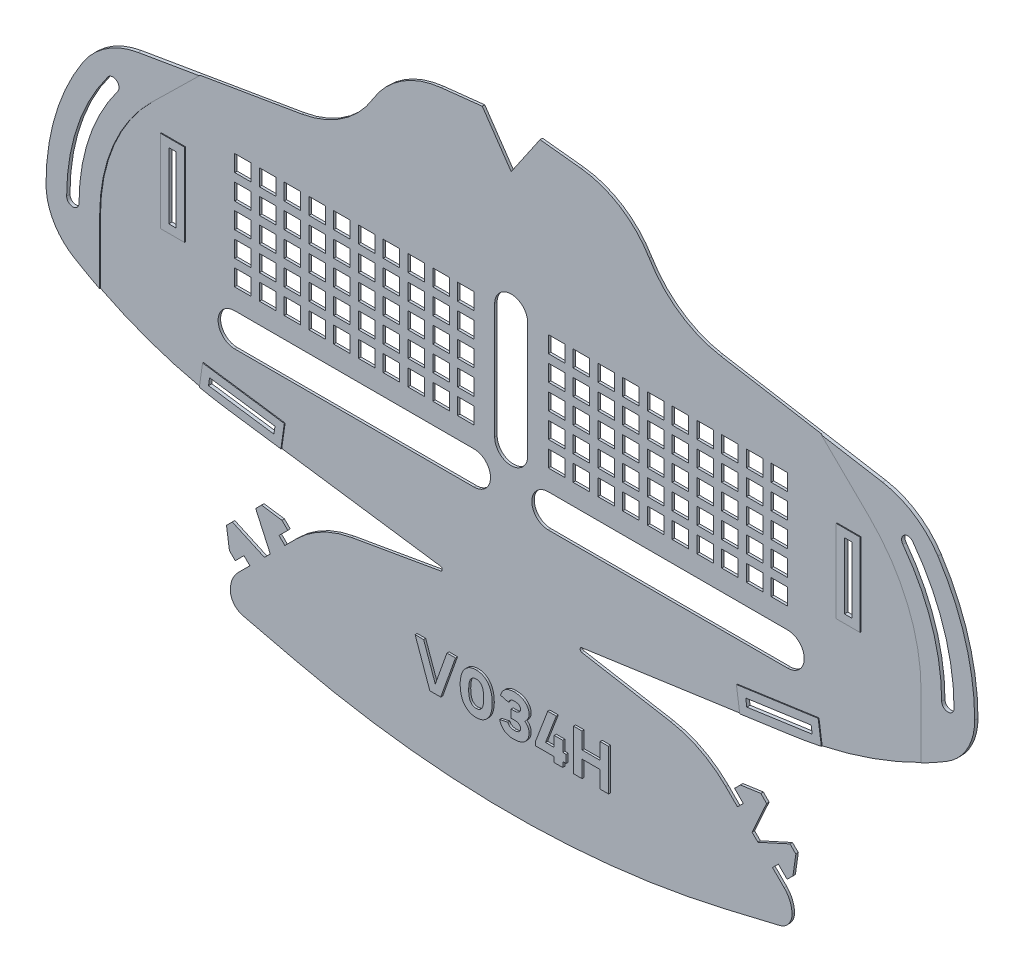
from build123d import *

# Parameters (mm, degrees)
MAIN_SHAPE_DEPTH                   = 0.6
ELASTIC_ATTACHMENT_POINTS_DEPTH    = 184.525502315
REINFORCED_ATTACHMENT_POINTS_DEPTH = 0.2
TAB_SLITS_DEPTH                    = 184.525502315
REINFORCED_TAB_SLITS_DEPTH         = 0.2
TAB_FLEX_RELIEF_DEPTH              = 184.525502315
TAB_FLEX_RELIEF_DEPTH_BACK         = 184.525502315
SKETCH3_W                          = 4
SKETCH3_H                          = 4
BREATHING_SLITS_DEPTH              = 184.525502315
VERSION_NUMBER_DEPTH               = 0.5
FILLET1_R                          = 0.5
TAB_OVERLAY_SLIT_DEPTH             = 184.525502394
TAB_OVERLAY_SLIT_DEPTH_BACK        = 184.525502394
SKETCH12_W                         = 1.8
SKETCH12_H                         = 16
SKETCH13_W                         = 5.8
SKETCH13_H                         = 20
SKETCH13_W_2                       = 1.8
SKETCH13_H_2                       = 16
TAB_OVERLAY_REINFORCEMENT_DEPTH    = 0.2


with BuildPart() as part:
    # Sketch1 → Main Shape (new body)
    with BuildSketch(Plane.XY):
        with BuildLine():
            Line((0, -10.235233266), (-7, 0))
            Line((-7, 0), (-16.941855461, -1.076805455))
            ThreePointArc((-16.941855461, -1.076805455), (-26.448172688, -4.42923559), (-33.461443341, -11.669600897))
            ThreePointArc((-33.461443341, -11.669600897), (-40.804108255, -19.481824954), (-50.74391922, -23.5))
            Line((-50.74391922, -23.5), (-90.180351554, -30.190874742))
            ThreePointArc((-90.180351554, -30.190874742), (-97.811505455, -33.190405434), (-103.597722286, -39))
            ThreePointArc((-103.597722286, -39), (-110.227482046, -53.35351039), (-112.5, -69))
            ThreePointArc((-112.5, -69), (-110.685143325, -75.893640703), (-105.711102551, -81))
            ThreePointArc((-105.711102551, -81), (-87.655491519, -89.524485559), (-68.266232563, -94.291935705))
            Line((-68.266232563, -94.291935705), (-14, -102))
            Line((-14, -102), (-38.626554922, -106.304973016))
            ThreePointArc((-38.626554922, -106.304973016), (-45.849449199, -108.748014338), (-52, -113.254607005))
            Line((-52, -113.254607005), (-54.828307349, -116.0831539))
            Line((-54.828307349, -116.0831539), (-56.242580797, -114.669000226))
            Line((-56.242580797, -114.669000226), (-54.121350285, -112.547590054))
            Line((-54.121350285, -112.547590054), (-55.535623732, -111.13343638))
            Line((-55.535623732, -111.13343638), (-60.48540114, -110.426539202))
            Line((-60.48540114, -110.426539202), (-68.970323187, -118.912179887))
            Line((-68.970323187, -118.912179887), (-68.263006804, -123.861897408))
            Line((-68.263006804, -123.861897408), (-66.848733357, -125.276051082))
            Line((-66.848733357, -125.276051082), (-64.727502845, -123.154640911))
            Line((-64.727502845, -123.154640911), (-63.313229397, -124.568794586))
            Line((-63.313229397, -124.568794586), (-66.141536747, -127.397341481))
            ThreePointArc((-66.141536747, -127.397341481), (-67.550417669, -129.506025763), (-68.045148042, -131.993340924))
            ThreePointArc((-68.045148042, -131.993340924), (-67.183295285, -134.473669911), (-64.9691321, -135.885159709))
            Line((-64.9691321, -135.885159709), (-52.436095294, -138.860716087))
            ThreePointArc((-52.436095294, -138.860716087), (-26.397134772, -143.459954927), (0, -145))
            ThreePointArc((0, -145), (26.397134772, -143.459954927), (52.436095294, -138.860716087))
            Line((52.436095294, -138.860716087), (64.9691321, -135.885159709))
            ThreePointArc((64.9691321, -135.885159709), (67.183295285, -134.473669911), (68.045148042, -131.993340924))
            ThreePointArc((68.045148042, -131.993340924), (67.550417669, -129.506025763), (66.141536747, -127.397341481))
            Line((66.141536747, -127.397341481), (63.313229397, -124.568794586))
            Line((63.313229397, -124.568794586), (64.727502845, -123.154640911))
            Line((64.727502845, -123.154640911), (66.848733357, -125.276051082))
            Line((66.848733357, -125.276051082), (68.263006804, -123.861897408))
            Line((68.263006804, -123.861897408), (68.970323187, -118.912179887))
            Line((68.970323187, -118.912179887), (60.48540114, -110.426539202))
            Line((60.48540114, -110.426539202), (55.535623732, -111.13343638))
            Line((55.535623732, -111.13343638), (54.121350285, -112.547590054))
            Line((54.121350285, -112.547590054), (56.242580797, -114.669000226))
            Line((56.242580797, -114.669000226), (54.828307349, -116.0831539))
            Line((54.828307349, -116.0831539), (52, -113.254607005))
            ThreePointArc((52, -113.254607005), (45.849449199, -108.748014338), (38.626554922, -106.304973016))
            Line((38.626554922, -106.304973016), (14, -102))
            Line((14, -102), (68.266232563, -94.291935705))
            ThreePointArc((68.266232563, -94.291935705), (87.655491519, -89.524485559), (105.711102551, -81))
            ThreePointArc((105.711102551, -81), (110.685143325, -75.893640703), (112.5, -69))
            ThreePointArc((112.5, -69), (110.227482046, -53.35351039), (103.597722286, -39))
            ThreePointArc((103.597722286, -39), (97.811505455, -33.190405434), (90.180351554, -30.190874742))
            Line((90.180351554, -30.190874742), (50.74391922, -23.5))
            ThreePointArc((50.74391922, -23.5), (40.804108255, -19.481824954), (33.461443341, -11.669600897))
            ThreePointArc((33.461443341, -11.669600897), (26.448172688, -4.42923559), (16.941855461, -1.076805455))
            Line((16.941855461, -1.076805455), (7, 0))
            Line((7, 0), (0, -10.235233266))
        make_face()
    extrude(amount=MAIN_SHAPE_DEPTH)

    # Sketch2 → Elastic Attachment Points (cut, through all)
    with BuildSketch(Plane.XY.offset(0.6)):
        with BuildLine():
            ThreePointArc((-97.5, -39), (-104.934164903, -53.188611699), (-107.5, -69))
            ThreePointArc((-107.5, -69), (-106, -70.5), (-104.5, -69))
            ThreePointArc((-104.5, -69), (-102.088115008, -54.137294997), (-95.1, -40.8))
            ThreePointArc((-95.1, -40.8), (-95.4, -38.7), (-97.5, -39))
        make_face()
        with BuildLine():
            ThreePointArc((97.5, -39), (104.934164903, -53.188611699), (107.5, -69))
            ThreePointArc((107.5, -69), (106, -70.5), (104.5, -69))
            ThreePointArc((104.5, -69), (102.088115008, -54.137294997), (95.1, -40.8))
            ThreePointArc((95.1, -40.8), (95.4, -38.7), (97.5, -39))
        make_face()
    extrude(amount=-ELASTIC_ATTACHMENT_POINTS_DEPTH, mode=Mode.SUBTRACT)

    # Sketch7 → Reinforced Attachment Points (add)
    # profile 1 of 2: a face of its own
    with BuildSketch(Plane.XY.offset(0.6)):
        with BuildLine():
            Line((-99.5, -69), (-99.5, -84.438405623))
            ThreePointArc((-99.5, -84.438405623), (-102.636073846, -82.774338486), (-105.711102551, -81))
            ThreePointArc((-105.711102551, -81), (-110.685143325, -75.893640703), (-112.5, -69))
            ThreePointArc((-112.5, -69), (-110.227482046, -53.35351039), (-103.597722286, -39))
            ThreePointArc((-103.597722286, -39), (-97.811505455, -33.190405434), (-90.180351554, -30.190874742))
            Line((-90.180351554, -30.190874742), (-75.331937335, -27.671659038))
            Line((-75.331937335, -27.671659038), (-86.893876913, -39))
            ThreePointArc((-86.893876913, -39), (-96.22042633, -52.729517991), (-99.5, -69))
        make_face()
        with BuildLine():
            ThreePointArc((-107.5, -69), (-106, -70.5), (-104.5, -69))
            ThreePointArc((-104.5, -69), (-102.088115008, -54.137294997), (-95.1, -40.8))
            ThreePointArc((-95.1, -40.8), (-95.4, -38.7), (-97.5, -39))
            ThreePointArc((-97.5, -39), (-104.934164903, -53.188611699), (-107.5, -69))
        make_face(mode=Mode.SUBTRACT)
    # profile 2 of 2: a face of its own
    with BuildSketch(Plane.XY.offset(0.6)):
        with BuildLine():
            Line((75.331937335, -27.671659038), (90.180351554, -30.190874742))
            ThreePointArc((90.180351554, -30.190874742), (97.811505455, -33.190405434), (103.597722286, -39))
            ThreePointArc((103.597722286, -39), (110.227482046, -53.35351039), (112.5, -69))
            ThreePointArc((112.5, -69), (110.685143325, -75.893640703), (105.711102551, -81))
            ThreePointArc((105.711102551, -81), (102.636073846, -82.774338486), (99.5, -84.438405623))
            Line((99.5, -84.438405623), (99.5, -69))
            ThreePointArc((99.5, -69), (96.22042633, -52.729517991), (86.893876913, -39))
            Line((86.893876913, -39), (75.331937335, -27.671659038))
        make_face()
        with BuildLine():
            ThreePointArc((104.5, -69), (106, -70.5), (107.5, -69))
            ThreePointArc((107.5, -69), (104.934164903, -53.188611699), (97.5, -39))
            ThreePointArc((97.5, -39), (95.4, -38.7), (95.1, -40.8))
            ThreePointArc((95.1, -40.8), (102.088115008, -54.137294997), (104.5, -69))
        make_face(mode=Mode.SUBTRACT)
    extrude(amount=REINFORCED_ATTACHMENT_POINTS_DEPTH)

    # Sketch6 → Tab Slits (cut, through all)
    with BuildSketch(Plane.XY.offset(0.6)):
        Polygon((-73.122472744, -91.582072346), (-57.281477317, -93.832153206), (-57.02834322, -92.050041221), (-72.869338647, -89.79996036), align=None)
        Polygon((73.122472744, -91.582072346), (72.869338647, -89.79996036), (57.02834322, -92.050041221), (57.281477317, -93.832153206), align=None)
    extrude(amount=-TAB_SLITS_DEPTH, mode=Mode.SUBTRACT)

    # Sketch9 → Reinforced Tab Slits (add)
    # profile 1 of 2: a face of its own
    with BuildSketch(Plane.XY.offset(0.6)):
        with BuildLine():
            Line((-55.582612996, -96.093537742), (-54.766958684, -90.3511769))
            Line((-54.766958684, -90.3511769), (-74.568202968, -87.538575825))
            Line((-74.568202968, -87.538575825), (-75.347469499, -93.024759795))
            ThreePointArc((-75.347469499, -93.024759795), (-71.81824936, -93.72204393), (-68.266232563, -94.291935705))
            Line((-68.266232563, -94.291935705), (-55.582612996, -96.093537742))
        make_face()
        Polygon((-57.281477317, -93.832153206), (-57.02834322, -92.050041221), (-72.869338647, -89.79996036), (-73.122472744, -91.582072346), align=None, mode=Mode.SUBTRACT)
    # profile 2 of 2: a face of its own
    with BuildSketch(Plane.XY.offset(0.6)):
        with BuildLine():
            Line((68.266232563, -94.291935705), (55.582612996, -96.093537742))
            Line((55.582612996, -96.093537742), (54.766958684, -90.3511769))
            Line((54.766958684, -90.3511769), (74.568202968, -87.538575825))
            Line((74.568202968, -87.538575825), (75.347469499, -93.024759795))
            ThreePointArc((75.347469499, -93.024759795), (71.81824936, -93.72204393), (68.266232563, -94.291935705))
        make_face()
        Polygon((57.02834322, -92.050041221), (72.869338647, -89.79996036), (73.122472744, -91.582072346), (57.281477317, -93.832153206), align=None, mode=Mode.SUBTRACT)
    extrude(amount=REINFORCED_TAB_SLITS_DEPTH)

    # Sketch11 → Tab Flex Relief (cut, two sides: drawn at the far end of the back side and taken through both)
    with BuildSketch(Plane.XY.offset(0.6).offset(-TAB_FLEX_RELIEF_DEPTH_BACK)):
        Polygon((-67.556169513, -117.49790644), (-59.777845211, -121.033110967), (-58.363691536, -119.618837519), (-61.899554814, -111.840812649), align=None)
        Polygon((61.899554814, -111.840812649), (67.556169513, -117.49790644), (59.777845211, -121.033110967), (58.363691536, -119.618837519), align=None)
    extrude(amount=TAB_FLEX_RELIEF_DEPTH + TAB_FLEX_RELIEF_DEPTH_BACK, mode=Mode.SUBTRACT)

    # Sketch3 → Breathing Slits (cut, through all)
    with BuildSketch(Plane.XY.offset(0.6)):
        with Locations((-11, -41.9)):
            Rectangle(SKETCH3_W, SKETCH3_H)
        with BuildLine():
            Line((4, -39.9), (4, -67.9))
            ThreePointArc((4, -67.9), (0, -71.9), (-4, -67.9))
            Line((-4, -67.9), (-4, -39.9))
            ThreePointArc((-4, -39.9), (0, -35.9), (4, -39.9))
        make_face()
        with Locations((-17, -41.9)):
            Rectangle(SKETCH3_W, SKETCH3_H)
        with Locations((-23, -41.9)):
            Rectangle(SKETCH3_W, SKETCH3_H)
        with Locations((-29, -41.9)):
            Rectangle(SKETCH3_W, SKETCH3_H)
        with Locations((-35, -41.9)):
            Rectangle(SKETCH3_W, SKETCH3_H)
        with BuildLine():
            Line((-67, -72.9), (-9, -72.9))
            ThreePointArc((-9, -72.9), (-5, -76.9), (-9, -80.9))
            Line((-9, -80.9), (-67, -80.9))
            ThreePointArc((-67, -80.9), (-71, -76.9), (-67, -72.9))
        make_face()
        with BuildLine():
            Line((67, -72.9), (9, -72.9))
            ThreePointArc((9, -72.9), (5, -76.9), (9, -80.9))
            Line((9, -80.9), (67, -80.9))
            ThreePointArc((67, -80.9), (71, -76.9), (67, -72.9))
        make_face()
        with Locations((-41, -41.9)):
            Rectangle(SKETCH3_W, SKETCH3_H)
        with Locations((-47, -41.9)):
            Rectangle(SKETCH3_W, SKETCH3_H)
        with Locations((-53, -41.9)):
            Rectangle(SKETCH3_W, SKETCH3_H)
        with Locations((-59, -41.9)):
            Rectangle(SKETCH3_W, SKETCH3_H)
        with Locations((-65, -41.9)):
            Rectangle(SKETCH3_W, SKETCH3_H)
        with Locations((-17, -47.9)):
            Rectangle(SKETCH3_W, SKETCH3_H)
        with Locations((-23, -47.9)):
            Rectangle(SKETCH3_W, SKETCH3_H)
        with Locations((-29, -47.9)):
            Rectangle(SKETCH3_W, SKETCH3_H)
        with Locations((-35, -47.9)):
            Rectangle(SKETCH3_W, SKETCH3_H)
        with Locations((-41, -47.9)):
            Rectangle(SKETCH3_W, SKETCH3_H)
        with Locations((-47, -47.9)):
            Rectangle(SKETCH3_W, SKETCH3_H)
        with Locations((-53, -47.9)):
            Rectangle(SKETCH3_W, SKETCH3_H)
        with Locations((-59, -47.9)):
            Rectangle(SKETCH3_W, SKETCH3_H)
        with Locations((-65, -47.9)):
            Rectangle(SKETCH3_W, SKETCH3_H)
        with Locations((-17, -53.9)):
            Rectangle(SKETCH3_W, SKETCH3_H)
        with Locations((-23, -53.9)):
            Rectangle(SKETCH3_W, SKETCH3_H)
        with Locations((-29, -53.9)):
            Rectangle(SKETCH3_W, SKETCH3_H)
        with Locations((-35, -53.9)):
            Rectangle(SKETCH3_W, SKETCH3_H)
        with Locations((-41, -53.9)):
            Rectangle(SKETCH3_W, SKETCH3_H)
        with Locations((-47, -53.9)):
            Rectangle(SKETCH3_W, SKETCH3_H)
        with Locations((-53, -53.9)):
            Rectangle(SKETCH3_W, SKETCH3_H)
        with Locations((-59, -53.9)):
            Rectangle(SKETCH3_W, SKETCH3_H)
        with Locations((-65, -53.9)):
            Rectangle(SKETCH3_W, SKETCH3_H)
        with Locations((-17, -59.9)):
            Rectangle(SKETCH3_W, SKETCH3_H)
        with Locations((-23, -59.9)):
            Rectangle(SKETCH3_W, SKETCH3_H)
        with Locations((-29, -59.9)):
            Rectangle(SKETCH3_W, SKETCH3_H)
        with Locations((-35, -59.9)):
            Rectangle(SKETCH3_W, SKETCH3_H)
        with Locations((-41, -59.9)):
            Rectangle(SKETCH3_W, SKETCH3_H)
        with Locations((-47, -59.9)):
            Rectangle(SKETCH3_W, SKETCH3_H)
        with Locations((-53, -59.9)):
            Rectangle(SKETCH3_W, SKETCH3_H)
        with Locations((-59, -59.9)):
            Rectangle(SKETCH3_W, SKETCH3_H)
        with Locations((-65, -59.9)):
            Rectangle(SKETCH3_W, SKETCH3_H)
        with Locations((-17, -65.9)):
            Rectangle(SKETCH3_W, SKETCH3_H)
        with Locations((-23, -65.9)):
            Rectangle(SKETCH3_W, SKETCH3_H)
        with Locations((-29, -65.9)):
            Rectangle(SKETCH3_W, SKETCH3_H)
        with Locations((-35, -65.9)):
            Rectangle(SKETCH3_W, SKETCH3_H)
        with Locations((-41, -65.9)):
            Rectangle(SKETCH3_W, SKETCH3_H)
        with Locations((-47, -65.9)):
            Rectangle(SKETCH3_W, SKETCH3_H)
        with Locations((-53, -65.9)):
            Rectangle(SKETCH3_W, SKETCH3_H)
        with Locations((-59, -65.9)):
            Rectangle(SKETCH3_W, SKETCH3_H)
        with Locations((-65, -65.9)):
            Rectangle(SKETCH3_W, SKETCH3_H)
        with Locations((-11, -47.9)):
            Rectangle(SKETCH3_W, SKETCH3_H)
        with Locations((-11, -53.9)):
            Rectangle(SKETCH3_W, SKETCH3_H)
        with Locations((-11, -59.9)):
            Rectangle(SKETCH3_W, SKETCH3_H)
        with Locations((-11, -65.9)):
            Rectangle(SKETCH3_W, SKETCH3_H)
        with Locations((11, -65.9)):
            Rectangle(SKETCH3_W, SKETCH3_H)
        with Locations((11, -59.9)):
            Rectangle(SKETCH3_W, SKETCH3_H)
        with Locations((11, -53.9)):
            Rectangle(SKETCH3_W, SKETCH3_H)
        with Locations((11, -47.9)):
            Rectangle(SKETCH3_W, SKETCH3_H)
        with Locations((65, -65.9)):
            Rectangle(SKETCH3_W, SKETCH3_H)
        with Locations((59, -65.9)):
            Rectangle(SKETCH3_W, SKETCH3_H)
        with Locations((53, -65.9)):
            Rectangle(SKETCH3_W, SKETCH3_H)
        with Locations((47, -65.9)):
            Rectangle(SKETCH3_W, SKETCH3_H)
        with Locations((41, -65.9)):
            Rectangle(SKETCH3_W, SKETCH3_H)
        with Locations((35, -65.9)):
            Rectangle(SKETCH3_W, SKETCH3_H)
        with Locations((29, -65.9)):
            Rectangle(SKETCH3_W, SKETCH3_H)
        with Locations((23, -65.9)):
            Rectangle(SKETCH3_W, SKETCH3_H)
        with Locations((17, -65.9)):
            Rectangle(SKETCH3_W, SKETCH3_H)
        with Locations((65, -59.9)):
            Rectangle(SKETCH3_W, SKETCH3_H)
        with Locations((59, -59.9)):
            Rectangle(SKETCH3_W, SKETCH3_H)
        with Locations((53, -59.9)):
            Rectangle(SKETCH3_W, SKETCH3_H)
        with Locations((47, -59.9)):
            Rectangle(SKETCH3_W, SKETCH3_H)
        with Locations((41, -59.9)):
            Rectangle(SKETCH3_W, SKETCH3_H)
        with Locations((35, -59.9)):
            Rectangle(SKETCH3_W, SKETCH3_H)
        with Locations((29, -59.9)):
            Rectangle(SKETCH3_W, SKETCH3_H)
        with Locations((23, -59.9)):
            Rectangle(SKETCH3_W, SKETCH3_H)
        with Locations((17, -59.9)):
            Rectangle(SKETCH3_W, SKETCH3_H)
        with Locations((65, -53.9)):
            Rectangle(SKETCH3_W, SKETCH3_H)
        with Locations((59, -53.9)):
            Rectangle(SKETCH3_W, SKETCH3_H)
        with Locations((53, -53.9)):
            Rectangle(SKETCH3_W, SKETCH3_H)
        with Locations((47, -53.9)):
            Rectangle(SKETCH3_W, SKETCH3_H)
        with Locations((41, -53.9)):
            Rectangle(SKETCH3_W, SKETCH3_H)
        with Locations((35, -53.9)):
            Rectangle(SKETCH3_W, SKETCH3_H)
        with Locations((29, -53.9)):
            Rectangle(SKETCH3_W, SKETCH3_H)
        with Locations((23, -53.9)):
            Rectangle(SKETCH3_W, SKETCH3_H)
        with Locations((17, -53.9)):
            Rectangle(SKETCH3_W, SKETCH3_H)
        with Locations((65, -47.9)):
            Rectangle(SKETCH3_W, SKETCH3_H)
        with Locations((59, -47.9)):
            Rectangle(SKETCH3_W, SKETCH3_H)
        with Locations((53, -47.9)):
            Rectangle(SKETCH3_W, SKETCH3_H)
        with Locations((47, -47.9)):
            Rectangle(SKETCH3_W, SKETCH3_H)
        with Locations((41, -47.9)):
            Rectangle(SKETCH3_W, SKETCH3_H)
        with Locations((35, -47.9)):
            Rectangle(SKETCH3_W, SKETCH3_H)
        with Locations((29, -47.9)):
            Rectangle(SKETCH3_W, SKETCH3_H)
        with Locations((23, -47.9)):
            Rectangle(SKETCH3_W, SKETCH3_H)
        with Locations((17, -47.9)):
            Rectangle(SKETCH3_W, SKETCH3_H)
        with Locations((65, -41.9)):
            Rectangle(SKETCH3_W, SKETCH3_H)
        with Locations((59, -41.9)):
            Rectangle(SKETCH3_W, SKETCH3_H)
        with Locations((53, -41.9)):
            Rectangle(SKETCH3_W, SKETCH3_H)
        with Locations((47, -41.9)):
            Rectangle(SKETCH3_W, SKETCH3_H)
        with Locations((41, -41.9)):
            Rectangle(SKETCH3_W, SKETCH3_H)
        with Locations((35, -41.9)):
            Rectangle(SKETCH3_W, SKETCH3_H)
        with Locations((29, -41.9)):
            Rectangle(SKETCH3_W, SKETCH3_H)
        with Locations((23, -41.9)):
            Rectangle(SKETCH3_W, SKETCH3_H)
        with Locations((17, -41.9)):
            Rectangle(SKETCH3_W, SKETCH3_H)
        with Locations((11, -41.9)):
            Rectangle(SKETCH3_W, SKETCH3_H)
    extrude(amount=-BREATHING_SLITS_DEPTH, mode=Mode.SUBTRACT)

    # Sketch8 → Version Number (add)
    # profile 1 of 5: a face of its own
    with BuildSketch(Plane.XY.offset(0.6)):
        Polygon((-19.203048121, -128.5), (-16.568127486, -128.5), (-12.996698915, -118.5), (-15.060190979, -118.5), (-17.885587804, -126.420634921), (-20.710984629, -118.5), (-22.774476693, -118.5), align=None)
    # profile 2 of 5: a face of its own
    with BuildSketch(Plane.XY.offset(0.6)):
        with BuildLine():
            add(Edge.make_bspline(
                [(-7.974524236, -118.5), (-8.118890199, -118.505695671), (-8.401645347, -118.51685121), (-8.814780348, -118.5745591), (-9.202623051, -118.680335178), (-9.569824627, -118.819656178), (-9.912100198, -119.003303471), (-10.235893373, -119.221085059), (-10.528903988, -119.487440084), (-10.804359041, -119.785519386), (-11.050222222, -120.12453761), (-11.263657932, -120.500892889), (-11.445620708, -120.912503383), (-11.594541872, -121.360169436), (-11.71009092, -121.844506854), (-11.797844859, -122.364485904), (-11.849399298, -122.921030718), (-11.860056028, -123.303893775), (-11.86553461, -123.500722112)],
                knots=[0, 0, 0, 0, 0.970159994, 1.900155169, 2.79438565, 3.665191596, 4.532301255, 5.397946305, 6.279238358, 7.185391655, 8.120220805, 9.085107467, 10.08639026, 11.138349125, 12.249459105, 13.427760297, 14.677622047, 16, 16, 16, 16], degree=3))
            add(Edge.make_bspline(
                [(-11.86553461, -123.500722112), (-11.860111219, -123.69832053), (-11.849602593, -124.081196856), (-11.797635523, -124.637697099), (-11.710189633, -125.156966907), (-11.594079776, -125.641884177), (-11.446137113, -126.090648826), (-11.263590488, -126.502814664), (-11.050280184, -126.879260377), (-10.804199004, -127.218032326), (-10.529807266, -127.51659595), (-10.23433972, -127.779877259), (-9.912988477, -128.000979952), (-9.569631173, -128.183632701), (-9.203078118, -128.324409639), (-8.814125039, -128.425104033), (-8.402346718, -128.488808035), (-8.119565345, -128.496221224), (-7.97542127, -128.5)],
                knots=[0, 0, 0, 0, 1.327400251, 2.57203543, 3.750234214, 4.861247624, 5.917991082, 6.919186852, 7.883989653, 8.818737555, 9.724812096, 10.602616666, 11.47109776, 12.338132057, 13.208862319, 14.101698703, 15.032365954, 16, 16, 16, 16], degree=3))
            add(Edge.make_bspline(
                [(-7.97542127, -128.5), (-7.831281601, -128.496210687), (-7.548508871, -128.488776824), (-7.136668457, -128.425221319), (-6.747246126, -128.323813307), (-6.379884648, -128.184839888), (-6.037495169, -128.000200623), (-5.716448762, -127.779984633), (-5.421050094, -127.516566079), (-5.146640294, -127.218040576), (-4.900559667, -126.879258594), (-4.687266925, -126.502813072), (-4.504645048, -126.090657611), (-4.35700731, -125.641847927), (-4.23969446, -125.157235462), (-4.157252314, -124.637275213), (-4.099596089, -124.081441513), (-4.09168572, -123.698369528), (-4.087604336, -123.500722112)],
                knots=[0, 0, 0, 0, 0.96765053, 1.898333634, 2.791185227, 3.666728435, 4.529238626, 5.397734515, 6.275554038, 7.181644014, 8.116407839, 9.081227075, 10.082439899, 11.139201358, 12.250233695, 13.427610983, 14.672766316, 16, 16, 16, 16], degree=3))
            add(Edge.make_bspline(
                [(-4.087604336, -123.500722112), (-4.091745166, -123.303845261), (-4.099801871, -122.920787111), (-4.15704585, -122.364907693), (-4.239794044, -121.844238468), (-4.35654368, -121.360205444), (-4.505161645, -120.912494629), (-4.687199463, -120.500894477), (-4.90061764, -120.124539393), (-5.146480234, -119.785511139), (-5.421953471, -119.487469991), (-5.714894679, -119.220977415), (-6.038379541, -119.004075275), (-6.379691189, -118.818455332), (-6.747701753, -118.680915067), (-7.136018385, -118.574534625), (-7.548867463, -118.516562336), (-7.831352294, -118.506550382), (-7.97542127, -118.501444225)],
                knots=[0, 0, 0, 0, 1.322391154, 2.572941942, 3.750582404, 4.861863084, 5.913983562, 6.915420183, 7.880455081, 8.815427849, 9.721720359, 10.603147806, 11.468925845, 12.331628829, 13.207367743, 14.101735605, 15.031873656, 16, 16, 16, 16], degree=3))
            Line((-7.97542127, -118.501444225), (-7.974524236, -118.5))
        make_face()
        with BuildLine():
            add(Edge.make_bspline(
                [(-7.974524236, -126.579365079), (-8.043843783, -126.580142247), (-8.179854109, -126.581667111), (-8.377307346, -126.549518886), (-8.563758441, -126.50001124), (-8.737935736, -126.424863461), (-8.901731097, -126.32888552), (-9.05234664, -126.207295998), (-9.190705664, -126.063513987), (-9.318020722, -125.896932623), (-9.431892024, -125.703005633), (-9.530423013, -125.478827118), (-9.611160428, -125.222713054), (-9.680337186, -124.937433189), (-9.731588551, -124.621763618), (-9.770092116, -124.276117752), (-9.79595878, -123.899148475), (-9.799318055, -123.63702081), (-9.801064779, -123.500722112)],
                knots=[0, 0, 0, 0, 0.820209436, 1.609314487, 2.362064528, 3.101854642, 3.850272983, 4.605479342, 5.3882482, 6.210255141, 7.084711649, 8.047345167, 9.106040688, 10.263495908, 11.523832392, 12.893430008, 14.384674726, 16, 16, 16, 16], degree=3))
            add(Edge.make_bspline(
                [(-9.801064779, -123.500722112), (-9.799311168, -123.364424703), (-9.795938649, -123.102299516), (-9.770163004, -122.725313211), (-9.73127003, -122.378974061), (-9.680973746, -122.063111109), (-9.610756323, -121.778059679), (-9.530453292, -121.522619394), (-9.431923131, -121.298401339), (-9.317888472, -121.104640769), (-9.191498168, -120.937923887), (-9.051535682, -120.796456824), (-8.901814931, -120.674830172), (-8.737975046, -120.578630118), (-8.563329026, -120.50465551), (-8.377961479, -120.450210023), (-8.179817771, -120.423926373), (-8.044374498, -120.422146526), (-7.97542127, -120.421240419)],
                knots=[0, 0, 0, 0, 1.616177311, 3.108208617, 4.478528655, 5.748482895, 6.897727805, 7.956981757, 8.920123036, 9.795040793, 10.617481319, 11.394165711, 12.149770419, 12.898583529, 13.63876386, 14.394368568, 15.182584207, 16, 16, 16, 16], degree=3))
            add(Edge.make_bspline(
                [(-7.97542127, -120.421240419), (-7.906469634, -120.422149219), (-7.77102949, -120.423934355), (-7.572863269, -120.450179948), (-7.387576682, -120.504762296), (-7.213243335, -120.577982734), (-7.051018, -120.675595023), (-6.901548242, -120.796360516), (-6.761647995, -120.937948802), (-6.635283683, -121.104645093), (-6.521058946, -121.298351736), (-6.423273665, -121.523063414), (-6.339313807, -121.777554553), (-6.270124708, -122.063195246), (-6.219495029, -122.378948588), (-6.180702915, -122.725320897), (-6.154897251, -123.102297333), (-6.1515291, -123.364423957), (-6.14977776, -123.500722112)],
                knots=[0, 0, 0, 0, 0.817669415, 1.606129616, 2.361968767, 3.102378757, 3.843623451, 4.599462602, 5.376387978, 6.199083685, 7.074272906, 8.037713021, 9.100132017, 10.249733507, 11.520081779, 12.89082699, 14.383321233, 16, 16, 16, 16], degree=3))
            add(Edge.make_bspline(
                [(-6.14977776, -123.500722112), (-6.151522214, -123.637021556), (-6.154877122, -123.899150658), (-6.180773797, -124.276110066), (-6.219176747, -124.621789015), (-6.270759966, -124.937349474), (-6.338901831, -125.223220708), (-6.423303343, -125.478383327), (-6.521090198, -125.703055181), (-6.635151377, -125.896928348), (-6.762440519, -126.063488884), (-6.90073661, -126.207393621), (-7.051100699, -126.328120602), (-7.213281926, -126.425517476), (-7.387147177, -126.499891817), (-7.573516514, -126.549600883), (-7.770706143, -126.581404352), (-7.906404679, -126.580608552), (-7.97542127, -126.580203806)],
                knots=[0, 0, 0, 0, 1.616177474, 3.108208932, 4.478529109, 5.739530511, 6.897596372, 7.959685938, 8.922827315, 9.797745161, 10.620185771, 11.403367596, 12.15897238, 12.899987232, 13.640167639, 14.39331481, 15.182836171, 16, 16, 16, 16], degree=3))
            Line((-7.97542127, -126.580203806), (-7.974524236, -126.579365079))
        make_face(mode=Mode.SUBTRACT)
    # profile 3 of 5: a face of its own
    with BuildSketch(Plane.XY.offset(0.6)):
        with BuildLine():
            Line((1.348080572, -124.404761905), (1.443318667, -124.404761905))
            add(Edge.make_bspline(
                [(1.443318667, -124.404761905), (1.543586562, -124.411299477), (1.734221764, -124.423729091), (2.00088806, -124.486416557), (2.233682149, -124.578961335), (2.425369526, -124.709274647), (2.579014828, -124.861365804), (2.693342267, -125.032278467), (2.763003511, -125.222537651), (2.771878948, -125.355662585), (2.776355979, -125.422814713)],
                knots=[0, 0, 0, 0, 1.293250512, 2.458803691, 3.516087315, 4.504014474, 5.424976382, 6.287022232, 7.135923681, 8, 8, 8, 8], degree=3))
            add(Edge.make_bspline(
                [(2.776355979, -125.422814713), (2.773066429, -125.504440638), (2.766705443, -125.662280257), (2.697558071, -125.887718235), (2.579203214, -126.087113891), (2.444287377, -126.23073656), (2.315122721, -126.331172702), (2.200233726, -126.395688771), (2.071382826, -126.450185226), (1.92835482, -126.49595932), (1.771633361, -126.532200484), (1.600674424, -126.560253509), (1.414850701, -126.575366879), (1.286011705, -126.5785552), (1.21939208, -126.580203806)],
                knots=[0, 0, 0, 0, 1.334208421, 2.579951764, 3.816761299, 5.103436918, 5.78324123, 6.491044783, 7.25516555, 8.072210043, 8.94833879, 9.888551629, 10.908219533, 12, 12, 12, 12], degree=3))
            add(Edge.make_bspline(
                [(1.21939208, -126.580203806), (1.144998489, -126.579024673), (0.994513896, -126.576639503), (0.76786735, -126.537785365), (0.539592392, -126.472292557), (0.312494993, -126.384048723), (0.098338392, -126.26078738), (-0.078984137, -126.088542309), (-0.220153892, -125.87591894), (-0.274723047, -125.712337396), (-0.303125715, -125.62719493)],
                knots=[0, 0, 0, 0, 0.920255672, 1.861508472, 2.836752399, 3.857684402, 4.873720033, 5.872631744, 6.892727297, 8, 8, 8, 8], degree=3))
            Line((-0.303125715, -125.62719493), (-2.286840063, -126.071428571))
            add(Edge.make_bspline(
                [(-2.286840063, -126.071428571), (-2.264004779, -126.160336196), (-2.219048634, -126.335369884), (-2.126039755, -126.586847228), (-2.014602317, -126.824009097), (-1.889445974, -127.050933458), (-1.741294887, -127.26169635), (-1.577126348, -127.459934114), (-1.397894818, -127.647890635), (-1.197562526, -127.819546753), (-0.980115548, -127.976110236), (-0.742968974, -128.112422888), (-0.488403476, -128.230322428), (-0.212866086, -128.322934743), (0.079251529, -128.399729339), (0.390520098, -128.45295857), (0.719351077, -128.491934936), (0.945232569, -128.497268097), (1.060940002, -128.5)],
                knots=[0, 0, 0, 0, 0.97897001, 1.927311989, 2.855460552, 3.773345826, 4.68872018, 5.599601379, 6.518067916, 7.456260856, 8.41049365, 9.372940738, 10.370680865, 11.39871829, 12.470472684, 13.590411754, 14.765692276, 16, 16, 16, 16], degree=3))
            add(Edge.make_bspline(
                [(1.060940002, -128.5), (1.217209888, -128.494245394), (1.519735938, -128.483104934), (1.957544727, -128.435865678), (2.363193109, -128.358387224), (2.736967901, -128.252017359), (3.081841595, -128.123277608), (3.392827015, -127.961059217), (3.67491845, -127.774497038), (3.922572472, -127.55815064), (4.136967185, -127.319870658), (4.328724759, -127.071551477), (4.486514051, -126.805353082), (4.619044704, -126.527874631), (4.717672328, -126.234513517), (4.789136032, -125.928607165), (4.830808433, -125.607680152), (4.835926067, -125.38925418), (4.838529403, -125.278141077)],
                knots=[0, 0, 0, 0, 1.338573179, 2.591371041, 3.766159492, 4.869841347, 5.915366975, 6.911991706, 7.866279139, 8.804635322, 9.718527085, 10.607232931, 11.486170613, 12.362759498, 13.235296616, 14.130311397, 15.048891017, 16, 16, 16, 16], degree=3))
            add(Edge.make_bspline(
                [(4.838529403, -125.278141077), (4.833180976, -125.181448476), (4.822654216, -124.991138356), (4.767338631, -124.713321084), (4.674978743, -124.451246621), (4.545787004, -124.20784025), (4.394587299, -123.977552327), (4.219455883, -123.764837772), (4.025058837, -123.566155092), (3.880634171, -123.449574998), (3.807442691, -123.39049458)],
                knots=[0, 0, 0, 0, 1.042147361, 2.051151675, 3.039496243, 4.024119517, 5.012016893, 6.002285516, 6.987598979, 8, 8, 8, 8], degree=3))
            add(Edge.make_bspline(
                [(3.807442691, -123.39049458), (3.880623725, -123.325162044), (4.024984482, -123.19628365), (4.219256604, -122.981710509), (4.39342731, -122.755542958), (4.546783062, -122.515248899), (4.673984587, -122.261642739), (4.766808676, -121.993228321), (4.822716939, -121.711764564), (4.833202326, -121.519933272), (4.838529403, -121.42247384)],
                knots=[0, 0, 0, 0, 1.026734164, 2.025389794, 3.025877614, 4.013273499, 5.006315215, 5.989929209, 6.978788314, 8, 8, 8, 8], degree=3))
            add(Edge.make_bspline(
                [(4.838529403, -121.42247384), (4.834447538, -121.322020203), (4.826428558, -121.124675201), (4.779485861, -120.835115028), (4.704307846, -120.558271626), (4.596865789, -120.294880847), (4.463450193, -120.042407113), (4.298638279, -119.803370965), (4.107609101, -119.574583887), (3.886778242, -119.361344215), (3.640079084, -119.166999953), (3.368270868, -118.995833154), (3.073732178, -118.84746887), (2.752956125, -118.730513446), (2.411040508, -118.632405283), (2.045160672, -118.562780212), (1.656085517, -118.515976725), (1.388697426, -118.506371293), (1.251541777, -118.501444225)],
                knots=[0, 0, 0, 0, 0.933249724, 1.833404674, 2.71837752, 3.592513965, 4.4704886, 5.365912677, 6.284554944, 7.234984132, 8.212272519, 9.196674926, 10.214289296, 11.269589965, 12.363543901, 13.515449053, 14.72555956, 16, 16, 16, 16], degree=3))
            add(Edge.make_bspline(
                [(1.251541777, -118.501444225), (1.138149425, -118.504384419), (0.916968666, -118.510119502), (0.594184396, -118.546209564), (0.288355091, -118.597359567), (-0.000463635, -118.671164203), (-0.271507192, -118.76520159), (-0.525229275, -118.877770477), (-0.761758809, -119.009217236), (-0.979362078, -119.161041577), (-1.179622654, -119.328960798), (-1.361019642, -119.510905494), (-1.525766636, -119.704452098), (-1.670300812, -119.91288512), (-1.799930287, -120.132286581), (-1.906465316, -120.36651166), (-2.001384275, -120.610059019), (-2.044788493, -120.780460499), (-2.066766237, -120.866743363)],
                knots=[0, 0, 0, 0, 1.229240767, 2.397731417, 3.51786287, 4.588673614, 5.625367482, 6.624717489, 7.594406979, 8.554388623, 9.496885304, 10.424058211, 11.336820069, 12.248524965, 13.170856983, 14.095351914, 15.035580601, 16, 16, 16, 16], degree=3))
            Line((-2.066766237, -120.866743363), (-0.159855936, -121.373015873))
            add(Edge.make_bspline(
                [(-0.159855936, -121.373015873), (-0.148558286, -121.326631527), (-0.12404211, -121.22597637), (-0.033540983, -121.081457089), (0.088307691, -120.927147787), (0.249520466, -120.771324055), (0.446898239, -120.625559671), (0.684988217, -120.514206488), (0.958072604, -120.446844288), (1.150902041, -120.430020784), (1.251541777, -120.421240419)],
                knots=[0, 0, 0, 0, 0.626586808, 1.359708585, 2.222843852, 3.223153095, 4.308434095, 5.447412619, 6.667777482, 8, 8, 8, 8], degree=3))
            add(Edge.make_bspline(
                [(1.251541777, -120.421240419), (1.323574763, -120.423218633), (1.461810252, -120.42701494), (1.659213574, -120.449676308), (1.839505201, -120.474391788), (2.000554607, -120.515621967), (2.146169614, -120.558109891), (2.270778801, -120.618078056), (2.381540135, -120.680273756), (2.496443823, -120.780934624), (2.610771814, -120.912654377), (2.713765766, -121.077310889), (2.773762781, -121.24921056), (2.775501849, -121.365405566), (2.776355979, -121.42247384)],
                knots=[0, 0, 0, 0, 1.26888152, 2.435057415, 3.499383416, 4.470882074, 5.362320585, 6.164854387, 6.902680001, 7.591682225, 8.843898063, 9.963361673, 10.999720905, 12, 12, 12, 12], degree=3))
            add(Edge.make_bspline(
                [(2.776355979, -121.42247384), (2.771285225, -121.49199044), (2.761207026, -121.630155711), (2.685928214, -121.827940252), (2.564402901, -122.008163808), (2.401076154, -122.171288708), (2.193740246, -122.307565764), (1.946203271, -122.408872593), (1.659322937, -122.47003825), (1.455468094, -122.480300003), (1.347990868, -122.485710249)],
                knots=[0, 0, 0, 0, 0.842573162, 1.674626639, 2.532888499, 3.465967991, 4.458251597, 5.524776888, 6.695002246, 8, 8, 8, 8], degree=3))
            Line((1.347990868, -122.485710249), (0.490937714, -122.484126984))
            Line((0.490937714, -122.484126984), (0.490937714, -124.404761905))
            Line((0.490937714, -124.404761905), (1.348080572, -124.404761905))
        make_face()
    # profile 4 of 5: a face of its own
    with BuildSketch(Plane.XY.offset(0.6)):
        Polygon((10.932300847, -128.5), (12.995792911, -128.5), (12.995792911, -127.246031746), (13.821189736, -127.246031746), (13.821189736, -125.325396825), (12.995792911, -125.325396825), (12.995792911, -122.785714286), (10.932300847, -122.785714286), (10.932300847, -125.325396825), (8.821189736, -125.325396825), (11.424364339, -118.5), (9.360872276, -118.5), (6.360872276, -126.388888889), (6.360872276, -127.246031746), (10.932300847, -127.246031746), align=None)
    # profile 5 of 5: a face of its own
    with BuildSketch(Plane.XY.offset(0.6)):
        Polygon((24.112048512, -118.5), (22.048556448, -118.5), (22.048556448, -122.468253968), (17.683477083, -122.468253968), (17.683477083, -118.5), (15.61998502, -118.5), (15.61998502, -128.5), (17.683477083, -128.5), (17.683477083, -124.388888889), (22.048556448, -124.388888889), (22.048556448, -128.5), (24.112048512, -128.5), align=None)
    extrude(amount=VERSION_NUMBER_DEPTH)

    # Fillet1
    fillet1_edges = [part.edges().sort_by_distance(p)[0] for p in [
        (-14, -102, 0.3),
        (14, -102, 0.3),
    ]]
    fillet(fillet1_edges, radius=FILLET1_R)

    # Sketch12 → Tab Overlay Slit (cut, two sides: drawn at the far end of the back side and taken through both)
    with BuildSketch(Plane.XY.offset(0.6).offset(-TAB_OVERLAY_SLIT_DEPTH_BACK)):
        with Locations((-81.845854153, -54.45)):
            Rectangle(SKETCH12_W, SKETCH12_H)
        with Locations((81.845854153, -54.45)):
            Rectangle(SKETCH12_W, SKETCH12_H)
    extrude(amount=TAB_OVERLAY_SLIT_DEPTH + TAB_OVERLAY_SLIT_DEPTH_BACK, mode=Mode.SUBTRACT)

    # Sketch13 → Tab Overlay Reinforcement (add)
    # profile 1 of 2: a face of its own
    with BuildSketch(Plane.XY.offset(0.6)):
        with Locations((-81.845854153, -54.45)):
            Rectangle(SKETCH13_W, SKETCH13_H)
        with Locations((-81.845854153, -54.45)):
            Rectangle(SKETCH13_W_2, SKETCH13_H_2, mode=Mode.SUBTRACT)
    # profile 2 of 2: a face of its own
    with BuildSketch(Plane.XY.offset(0.6)):
        with Locations((81.845854153, -54.45)):
            Rectangle(SKETCH13_W, SKETCH13_H)
        with Locations((81.845854153, -54.45)):
            Rectangle(SKETCH13_W_2, SKETCH13_H_2, mode=Mode.SUBTRACT)
    extrude(amount=TAB_OVERLAY_REINFORCEMENT_DEPTH)


solid = part.part
